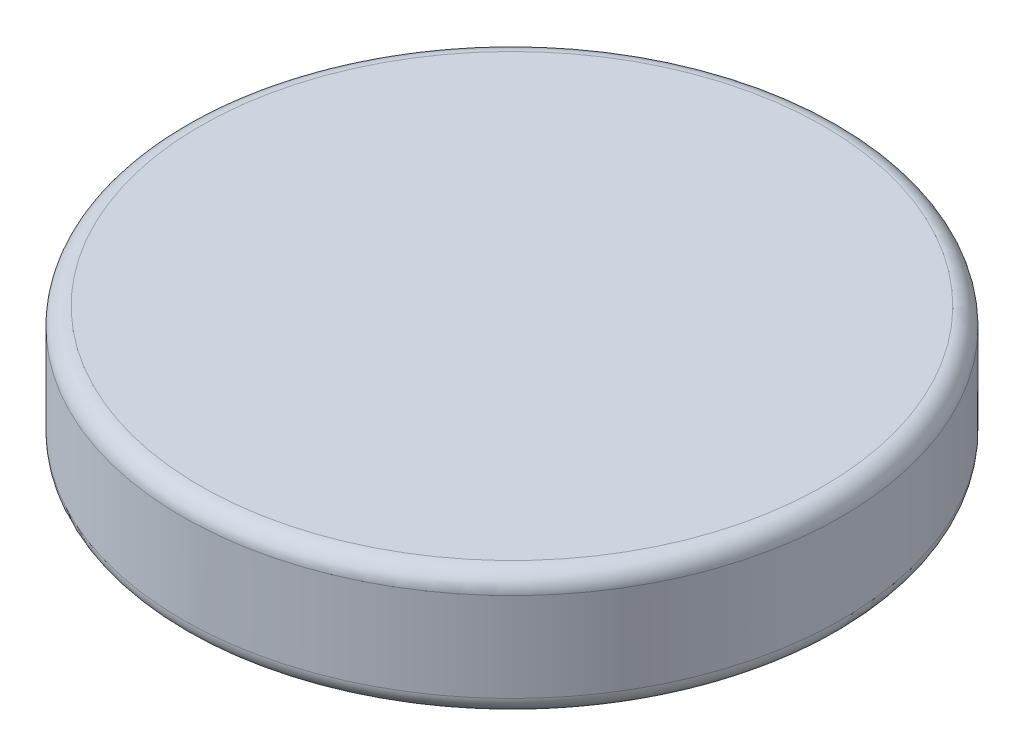
from build123d import *

# Parameters (mm, degrees)
SKETCH3_R          = 4.141637382
CUT_EXTRUDE1_DEPTH = 10
FILLET2_R          = 1
FILLET3_R          = 1


with BuildPart() as part:
    # Sketch2 → Revolve1 (revolve)
    with BuildSketch(Plane.XY):
        with BuildLine():
            Line((1.5, 1.5), (1.5, 5.5))
            ThreePointArc((1.5, 5.5), (1.207106781, 6.207106781), (0.5, 6.5))
            Line((0.5, 6.5), (-9.5, 6.5))
            Line((-9.5, 6.5), (-9.5, 13.5))
            Line((-9.5, 13.5), (9, 13.5))
            Line((9, 13.5), (9, 1.5))
            Line((9, 1.5), (1.5, 1.5))
        make_face()
    revolve(axis=Axis((9, 1.5, 0), (0, 1, 0)))

    # Sketch3 → Cut-Extrude1 (cut)
    with BuildSketch(Plane.XZ.offset(-1.5)):
        with Locations((9, 0)):
            Circle(SKETCH3_R)
    extrude(amount=-CUT_EXTRUDE1_DEPTH, mode=Mode.SUBTRACT)

    # Fillet2
    fillet2_edges = [part.edges().sort_by_distance(p)[0] for p in [
        (27.5, 13.5, 0),
        (27.5, 6.5, 0),
    ]]
    fillet(fillet2_edges, radius=FILLET2_R)

    # Fillet3
    fillet3_edges = [part.edges().sort_by_distance(p)[0] for p in [
        (16.5, 1.5, 0),
    ]]
    fillet(fillet3_edges, radius=FILLET3_R)


solid = part.part
